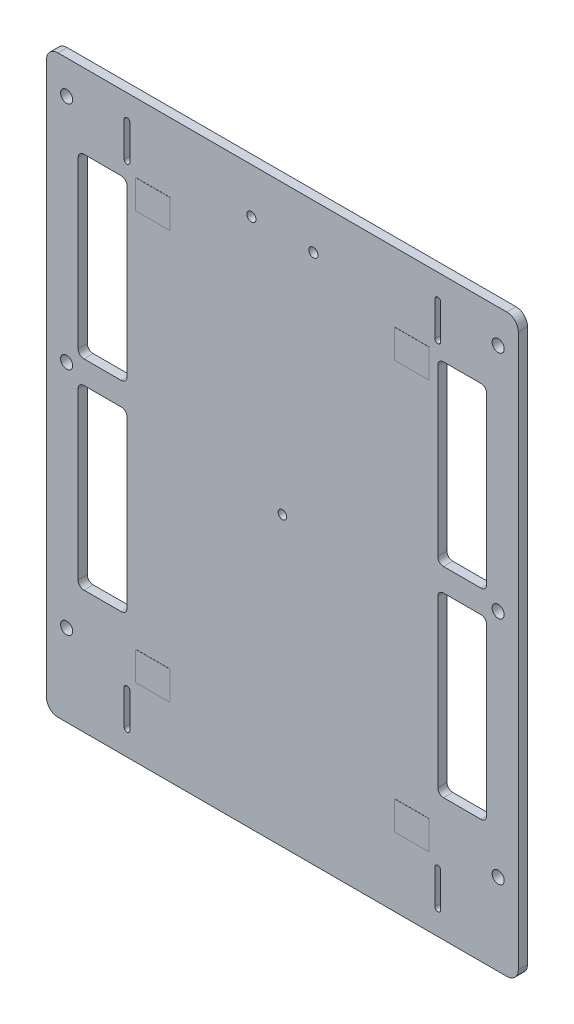
from build123d import *

# Parameters (mm, degrees)
BOSS_EXTRUDE1_DEPTH = 1.6
SKETCH2_R           = 0.75
SKETCH2_R_2         = 1.05
SKETCH2_R_3         = 0.8
CUT_EXTRUDE1_DEPTH  = 65.680445267
CUT_EXTRUDE2_DEPTH  = 65.680445267
CUT_EXTRUDE3_DEPTH  = 1.6
SKETCH5_W           = 6
SKETCH5_H           = 5
BOSS_EXTRUDE2_DEPTH = 0.02


with BuildPart() as part:
    # Sketch1 → Boss-Extrude1 (new body)
    with BuildSketch(Plane.XY):
        with BuildLine():
            Line((-39, -50), (39, -50))
            ThreePointArc((39, -50), (40.414213562, -49.414213562), (41, -48))
            Line((41, -48), (41, 48))
            ThreePointArc((41, 48), (40.414213562, 49.414213562), (39, 50))
            Line((39, 50), (-39, 50))
            ThreePointArc((-39, 50), (-40.414213562, 49.414213562), (-41, 48))
            Line((-41, 48), (-41, -48))
            ThreePointArc((-41, -48), (-40.414213562, -49.414213562), (-39, -50))
        make_face()
    extrude(amount=BOSS_EXTRUDE1_DEPTH)

    # Sketch2 → Cut-Extrude1 (cut, through all)
    with BuildSketch(Plane.XY.offset(1.6)):
        Circle(SKETCH2_R)
        with Locations((-37.5, 44.2)):
            Circle(SKETCH2_R_2)
        with Locations((37.5, 44.2)):
            Circle(SKETCH2_R_2)
        with Locations((37.5, 4.2)):
            Circle(SKETCH2_R_2)
        with Locations((37.5, -35.8)):
            Circle(SKETCH2_R_2)
        with Locations((-37.5, 4.2)):
            Circle(SKETCH2_R_2)
        with Locations((-37.5, -35.8)):
            Circle(SKETCH2_R_2)
        with Locations((-5.38, 42.15)):
            Circle(SKETCH2_R_3)
        with Locations((5.39, 42.15)):
            Circle(SKETCH2_R_3)
    extrude(amount=-CUT_EXTRUDE1_DEPTH, mode=Mode.SUBTRACT)

    # Sketch3 → Cut-Extrude2 (cut, through all)
    with BuildSketch(Plane.XY.offset(1.6)):
        with BuildLine():
            Line((-34.5, 37), (-28, 37))
            ThreePointArc((-28, 37), (-27.292893219, 36.707106781), (-27, 36))
            Line((-27, 36), (-27, 7.2))
            ThreePointArc((-27, 7.2), (-27.292893219, 6.492893219), (-28, 6.2))
            Line((-28, 6.2), (-34.5, 6.2))
            ThreePointArc((-34.5, 6.2), (-35.207106781, 6.492893219), (-35.5, 7.2))
            Line((-35.5, 7.2), (-35.5, 36))
            ThreePointArc((-35.5, 36), (-35.207106781, 36.707106781), (-34.5, 37))
        make_face()
        with BuildLine():
            Line((28, 37), (34.5, 37))
            ThreePointArc((34.5, 37), (35.207106781, 36.707106781), (35.5, 36))
            Line((35.5, 36), (35.5, 7.2))
            ThreePointArc((35.5, 7.2), (35.207106781, 6.492893219), (34.5, 6.2))
            Line((34.5, 6.2), (28, 6.2))
            ThreePointArc((28, 6.2), (27.292893219, 6.492893219), (27, 7.2))
            Line((27, 7.2), (27, 36))
            ThreePointArc((27, 36), (27.292893219, 36.707106781), (28, 37))
        make_face()
        with BuildLine():
            Line((28, 2.2), (34.5, 2.2))
            ThreePointArc((34.5, 2.2), (35.207106781, 1.907106781), (35.5, 1.2))
            Line((35.5, 1.2), (35.5, -27.6))
            ThreePointArc((35.5, -27.6), (35.207106781, -28.307106781), (34.5, -28.6))
            Line((34.5, -28.6), (28, -28.6))
            ThreePointArc((28, -28.6), (27.292893219, -28.307106781), (27, -27.6))
            Line((27, -27.6), (27, 1.2))
            ThreePointArc((27, 1.2), (27.292893219, 1.907106781), (28, 2.2))
        make_face()
        with BuildLine():
            Line((-34.5, 2.2), (-28, 2.2))
            ThreePointArc((-28, 2.2), (-27.292893219, 1.907106781), (-27, 1.2))
            Line((-27, 1.2), (-27, -27.6))
            ThreePointArc((-27, -27.6), (-27.292893219, -28.307106781), (-28, -28.6))
            Line((-28, -28.6), (-34.5, -28.6))
            ThreePointArc((-34.5, -28.6), (-35.207106781, -28.307106781), (-35.5, -27.6))
            Line((-35.5, -27.6), (-35.5, 1.2))
            ThreePointArc((-35.5, 1.2), (-35.207106781, 1.907106781), (-34.5, 2.2))
        make_face()
    extrude(amount=-CUT_EXTRUDE2_DEPTH, mode=Mode.SUBTRACT)

    # Sketch4 → Cut-Extrude3 (cut)
    with BuildSketch(Plane.XY.offset(1.6)):
        with BuildLine():
            Line((-27.5, 39.75), (-27.5, 45.75))
            ThreePointArc((-27.5, 45.75), (-27, 46.25), (-26.5, 45.75))
            Line((-26.5, 45.75), (-26.5, 39.75))
            ThreePointArc((-26.5, 39.75), (-27, 39.25), (-27.5, 39.75))
        make_face()
        with BuildLine():
            Line((26.5, 39.75), (26.5, 45.75))
            ThreePointArc((26.5, 45.75), (27, 46.25), (27.5, 45.75))
            Line((27.5, 45.75), (27.5, 39.75))
            ThreePointArc((27.5, 39.75), (27, 39.25), (26.5, 39.75))
        make_face()
        with BuildLine():
            Line((26.5, -45.75), (26.5, -39.75))
            ThreePointArc((26.5, -39.75), (27, -39.25), (27.5, -39.75))
            Line((27.5, -39.75), (27.5, -45.75))
            ThreePointArc((27.5, -45.75), (27, -46.25), (26.5, -45.75))
        make_face()
        with BuildLine():
            Line((-27.5, -45.75), (-27.5, -39.75))
            ThreePointArc((-27.5, -39.75), (-27, -39.25), (-26.5, -39.75))
            Line((-26.5, -39.75), (-26.5, -45.75))
            ThreePointArc((-26.5, -45.75), (-27, -46.25), (-27.5, -45.75))
        make_face()
    extrude(amount=-CUT_EXTRUDE3_DEPTH, mode=Mode.SUBTRACT)

    # Sketch5 → Boss-Extrude2 (add)
    with BuildSketch(Plane.XY.offset(1.6)):
        with Locations((-22.5, 35.5)):
            Rectangle(SKETCH5_W, SKETCH5_H)
        with Locations((22.5, 35.5)):
            Rectangle(SKETCH5_W, SKETCH5_H)
        with Locations((22.5, -35.5)):
            Rectangle(SKETCH5_W, SKETCH5_H)
        with Locations((-22.5, -35.5)):
            Rectangle(SKETCH5_W, SKETCH5_H)
    extrude(amount=BOSS_EXTRUDE2_DEPTH)


solid = part.part
